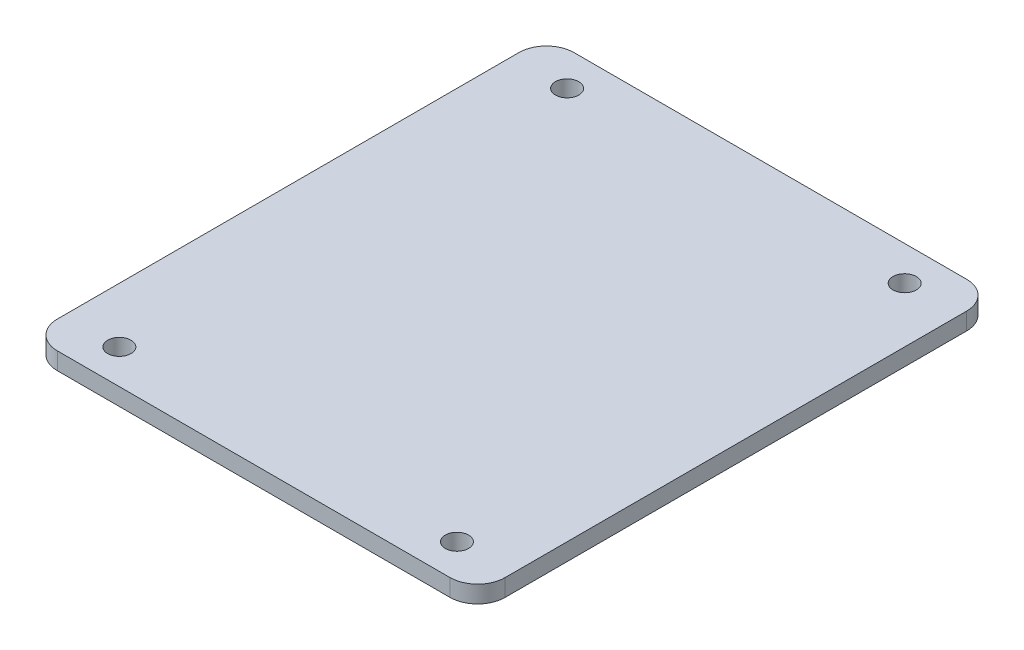
from build123d import *

# Parameters (mm, degrees)
SKETCH1_W             = 82.55
SKETCH1_H             = 95.25
MAIN_EXTRUSION_DEPTH  = 3.175
SKETCH2_R             = 2.15
STAND_OFF_HOLES_DEPTH = 64.101876953
FILLET1_R             = 5.08


with BuildPart() as part:
    # Sketch1 → Main Extrusion (new body)
    with BuildSketch(Plane(origin=(0, 0, 0), x_dir=(1, 0, 0), z_dir=(0, 1, 0))):
        Rectangle(SKETCH1_W, SKETCH1_H)
    extrude(amount=MAIN_EXTRUSION_DEPTH)

    # Sketch2 → Stand off holes (cut, through all)
    with BuildSketch(Plane(origin=(0, 0, 0), x_dir=(-1, 0, 0), z_dir=(0, -1, 0))):
        with Locations((-31.115, -41.275)):
            Circle(SKETCH2_R)
        with Locations((-31.115, 41.275)):
            Circle(SKETCH2_R)
        with Locations((31.115, 41.275)):
            Circle(SKETCH2_R)
        with Locations((31.115, -41.275)):
            Circle(SKETCH2_R)
    extrude(amount=-STAND_OFF_HOLES_DEPTH, mode=Mode.SUBTRACT)

    # Fillet1
    fillet1_edges = [part.edges().sort_by_distance(p)[0] for p in [
        (41.275, 1.5875, -47.625),
        (-41.275, 1.5875, -47.625),
        (-41.275, 1.5875, 47.625),
        (41.275, 1.5875, 47.625),
    ]]
    fillet(fillet1_edges, radius=FILLET1_R)


solid = part.part
